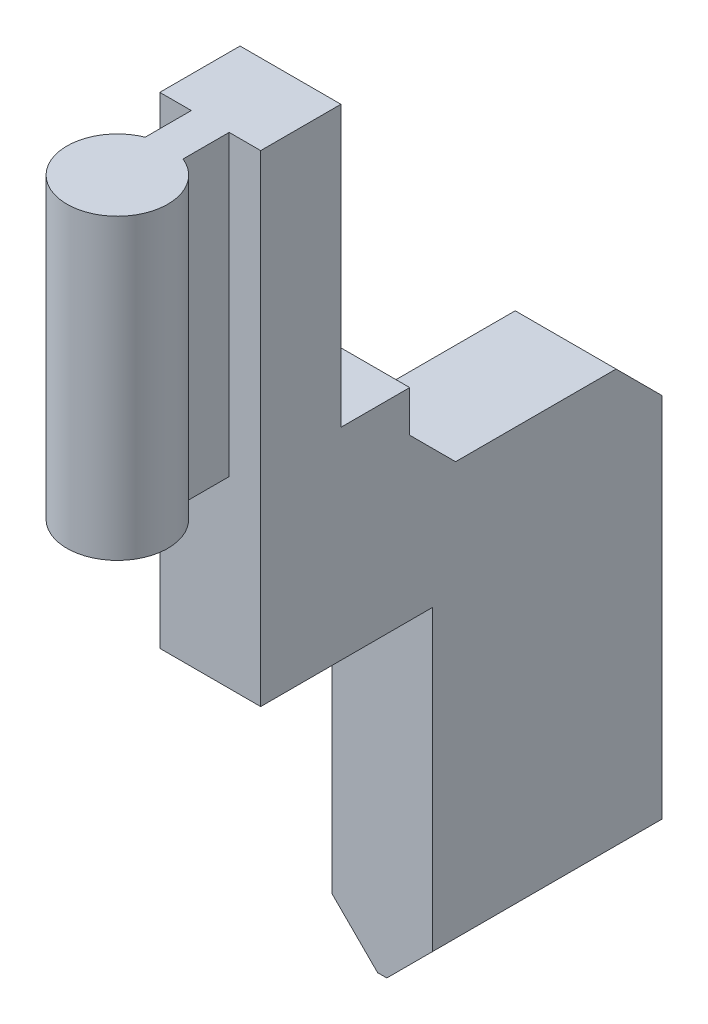
from build123d import *

# Parameters (mm, degrees)
SZKIC1_W                    = 4.4
SZKIC1_H                    = 21
DODANIE_WYCI_GNI_CIE1_DEPTH = 6.5
DODANIE_WYCI_GNI_CIE2_DEPTH = 13
SKETCH1_W                   = 4.4
SKETCH1_H                   = 5
BOSS_EXTRUDE1_DEPTH         = 11
SKETCH3_W                   = 4.4
SKETCH3_H                   = 10
BOSS_EXTRUDE3_DEPTH         = 15
CHAMFER1_SIZE               = 2
SKETCH5_W                   = 4.4
SKETCH5_H                   = 3
CUT_EXTRUDE1_DEPTH          = 12.2


with BuildPart() as part:
    # Szkic1 → Dodanie-wyciągnięcie1 (new body)
    with BuildSketch(Plane.XY):
        Rectangle(SZKIC1_W, SZKIC1_H)
    extrude(amount=DODANIE_WYCI_GNI_CIE1_DEPTH)

    # Szkic3 → Dodanie-wyciągnięcie2 (add)
    with BuildSketch(Plane(origin=(0, 10.5, 0), x_dir=(1, 0, 0), z_dir=(0, 1, 0))):
        with BuildLine():
            Line((0.825, -8.510545416), (0.825, -6.5))
            Line((0.825, -6.5), (-0.825, -6.5))
            Line((-0.825, -6.5), (-0.825, -8.510545416))
            ThreePointArc((-0.825, -8.510545416), (0, -12.75), (0.825, -8.510545416))
        make_face()
    extrude(amount=-DODANIE_WYCI_GNI_CIE2_DEPTH)

    # Sketch1 → Boss-Extrude1 (add)
    with BuildSketch(Plane(origin=(0, 0, 0), x_dir=(-1, 0, 0), z_dir=(0, 0, -1))):
        with Locations((0, -8)):
            Rectangle(SKETCH1_W, SKETCH1_H)
    extrude(amount=BOSS_EXTRUDE1_DEPTH)

    # Sketch3 → Boss-Extrude3 (add)
    with BuildSketch(Plane.XZ.offset(10.5)):
        with Locations((0, -6)):
            Rectangle(SKETCH3_W, SKETCH3_H)
    extrude(amount=BOSS_EXTRUDE3_DEPTH)

    # Chamfer1
    chamfer1_edges = [part.edges().sort_by_distance(p)[0] for p in [
        (2.2, -25.5, -6),
        (-2.2, -25.5, -6),
        (0, -5.5, 0),
        (0, -5.5, -11),
    ]]
    chamfer(chamfer1_edges, length=CHAMFER1_SIZE)

    # Sketch5 → Cut-Extrude1 (cut)
    with BuildSketch(Plane(origin=(0, 10.5, 0), x_dir=(1, 0, 0), z_dir=(0, 1, 0))):
        with Locations((0, -1.5)):
            Rectangle(SKETCH5_W, SKETCH5_H)
    extrude(amount=-CUT_EXTRUDE1_DEPTH, mode=Mode.SUBTRACT)


solid = part.part
